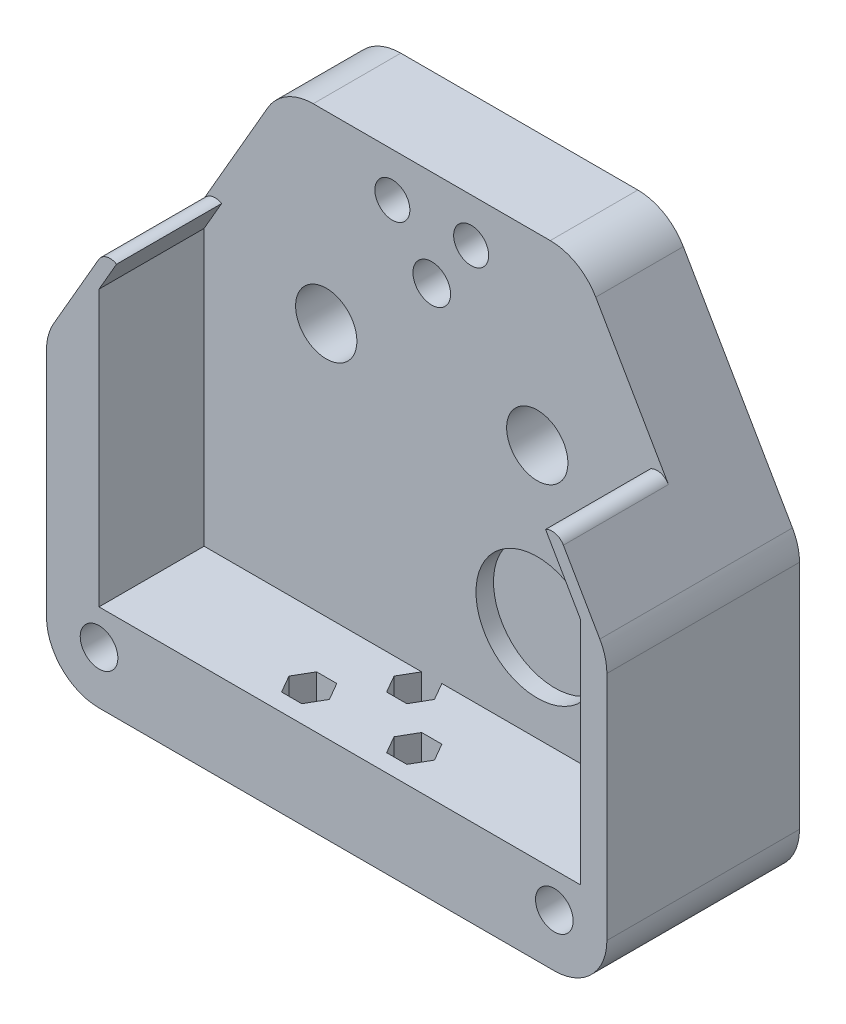
from build123d import *

# Parameters (mm, degrees)
EXTRUDE_1_DEPTH             = 10
EXTRUDE_2_DEPTH             = 12
FILLET_1_R                  = 6
FILLET_2_R                  = 1.49
HOLE_WIZARD_M44_D           = 4.3
HOLE_WIZARD_M44_CSINK_D     = 8.7
HOLE_WIZARD_M44_CSINK_ANGLE = 90
HOLE_WIZARD_4_0_2_D         = 4
HOLE_WIZARD_4_0_2_DEPTH     = 6
HOLE_WIZARD_4_0_2_TIP       = 1.2017212380551205
HOLE_WIZARD_7_0_7_1_D       = 7
HOLE_WIZARD_7_0_7_1_DEPTH   = 6
HOLE_WIZARD_7_0_7_1_TIP     = 2.103012166596461
SKETCH_54_R                 = 6.999999999999999
CUT_EXTRUDE_5_DEPTH         = 2
HOLE_WIZARD_M2_21_D         = 2
HOLE_WIZARD_M2_21_DEPTH     = 10
HOLE_WIZARD_M2_21_TIP       = 0.6008606190275603
CUT_EXTRUDE_11_DEPTH        = 4
HOLE_WIZARD_M2_22_D         = 2
HOLE_WIZARD_M2_22_DEPTH     = 10
HOLE_WIZARD_M2_22_TIP       = 0.6008606190275603
CUT_EXTRUDE_12_DEPTH        = 4


with BuildPart() as part:
    # Эскиз1 → Бобышка-Вытянуть1 (new body)
    with BuildSketch(Plane.XY):
        Polygon((0, 0), (64, 0), (64.00000000000001, 34.01923788646688), (48.99999999999994, 59.99999999999999), (14.999999999999943, 59.99999999999999), (0, 34.02), align=None)
    extrude(amount=EXTRUDE_1_DEPTH)

    # Эскиз3 → Бобышка-Вытянуть2 (add)
    with BuildSketch(Plane.XY.offset(10)):
        Polygon((0, 0), (64, 0), (64.00000000000001, 34.01923788646688), (58.29037785163881, 43.90859353944907), (57, 43.16359353944907), (60.99999999999999, 36.23539030917355), (61.00000000000001, 9.999999999999998), (6.000000000000005, 9.999999999999993), (6, 41.43206556072121), (8.000044001452048, 44.896141771236174), (6.709675613035229, 45.64115816177706), (0, 34.02), align=None)
    extrude(amount=EXTRUDE_2_DEPTH)

    # Скругление1
    fillet_1_edges = [part.edges().sort_by_distance(p)[0] for p in [
        (0, 34.02, 11),
        (14.999999999999943, 59.99999999999999, 5),
        (48.99999999999994, 59.99999999999999, 5),
        (64.00000000000001, 34.01923788646688, 11),
        (64, 0, 11),
        (0, 0, 11),
    ]]
    fillet(fillet_1_edges, radius=FILLET_1_R)

    # Скругление2
    fillet_2_edges = [part.edges().sort_by_distance(p)[0] for p in [
        (58.29037785163881, 43.90859353944907, 16),
        (6.709675613035229, 45.64115816177706, 16),
    ]]
    fillet(fillet_2_edges, radius=FILLET_2_R - 0.0001)  # a hair under: the kernel refuses the full size

    # Зенковка для  винта с плоской головкой M44 (through all)
    with Locations(Plane(origin=(0, 0, 0), x_dir=(-1, 0, 0), z_dir=(0, 0, -1))):
        with Locations((-5.999949191, 6), (-58, 6), (-31.999974596, 49)):
            CounterSinkHole(HOLE_WIZARD_M44_D / 2, HOLE_WIZARD_M44_CSINK_D / 2, counter_sink_angle=HOLE_WIZARD_M44_CSINK_ANGLE)

    # Отверстия под штифты Ø4.0 мм2
    with Locations(Plane(origin=(0, 0, 10), x_dir=(-1, 0, 0), z_dir=(0, 0, 1))):
        with Locations((-36.5, -55), (-27.499949191, -55)):
            Hole(HOLE_WIZARD_4_0_2_D / 2, depth=HOLE_WIZARD_4_0_2_DEPTH)
            with Locations((0, 0, -(HOLE_WIZARD_4_0_2_DEPTH + HOLE_WIZARD_4_0_2_TIP / 2))):  # 118° drill point
                Cone(0, HOLE_WIZARD_4_0_2_D / 2, HOLE_WIZARD_4_0_2_TIP, mode=Mode.SUBTRACT)

    # Диаметр отверстия Ø7.0 (7)1
    with Locations(Plane(origin=(0, 0, 10), x_dir=(-1, 0, 0), z_dir=(0, 0, 1))):
        with Locations((-44.05, -39), (-19.949949191, -39)):
            Hole(HOLE_WIZARD_7_0_7_1_D / 2, depth=HOLE_WIZARD_7_0_7_1_DEPTH)
            with Locations((0, 0, -(HOLE_WIZARD_7_0_7_1_DEPTH + HOLE_WIZARD_7_0_7_1_TIP / 2))):  # 118° drill point
                Cone(0, HOLE_WIZARD_7_0_7_1_D / 2, HOLE_WIZARD_7_0_7_1_TIP, mode=Mode.SUBTRACT)

    # Эскиз54 → Вырез-Вытянуть5 (cut)
    with BuildSketch(Plane.XY.offset(10)):
        with Locations((44.050000000000004, 21)):
            Circle(SKETCH_54_R)
    extrude(amount=-CUT_EXTRUDE_5_DEPTH, mode=Mode.SUBTRACT)

    # Сверло под метчик  спиральное M2.21
    with Locations(Plane(origin=(0, 0, 0), x_dir=(-1, 0, 0), z_dir=(0, -1, 0))):
        with Locations((-26, -18), (-38, -18)):
            Hole(HOLE_WIZARD_M2_21_D / 2, depth=HOLE_WIZARD_M2_21_DEPTH)
            with Locations((0, 0, -(HOLE_WIZARD_M2_21_DEPTH + HOLE_WIZARD_M2_21_TIP / 2))):  # 118° drill point
                Cone(0, HOLE_WIZARD_M2_21_D / 2, HOLE_WIZARD_M2_21_TIP, mode=Mode.SUBTRACT)

    # Эскиз58 → Вырез-Вытянуть11 (cut)
    with BuildSketch(Plane(origin=(-9.5e-16, 9.999999999999993, 0), x_dir=(1, 9e-17, 0), z_dir=(-9e-17, 1, 0))):
        Polygon((28.309401076758505, -17.999999999999993), (27.154700538379252, -15.99999999999999), (24.845299461620748, -15.999999999999986), (23.690598923241495, -17.999999999999986), (24.845299461620744, -19.999999999999982), (27.154700538379256, -19.999999999999986), align=None)
        Polygon((40.3094010767585, -17.999999999999993), (39.154700538379245, -15.999999999999993), (36.845299461620755, -15.99999999999999), (35.6905989232415, -17.999999999999996), (36.84529946162075, -19.999999999999993), (39.15470053837924, -19.999999999999996), align=None)
    extrude(amount=-CUT_EXTRUDE_11_DEPTH, mode=Mode.SUBTRACT)

    # Сверло под метчик  спиральное M2.22
    with Locations(Plane(origin=(0, 0, 0), x_dir=(-1, 0, 0), z_dir=(0, -1, 0))):
        with Locations((-32, -12)):
            Hole(HOLE_WIZARD_M2_22_D / 2, depth=HOLE_WIZARD_M2_22_DEPTH)
            with Locations((0, 0, -(HOLE_WIZARD_M2_22_DEPTH + HOLE_WIZARD_M2_22_TIP / 2))):  # 118° drill point
                Cone(0, HOLE_WIZARD_M2_22_D / 2, HOLE_WIZARD_M2_22_TIP, mode=Mode.SUBTRACT)

    # Эскиз61 → Вырез-Вытянуть12 (cut)
    with BuildSketch(Plane(origin=(-9.5e-16, 9.999999999999993, 0), x_dir=(1, 9e-17, 0), z_dir=(-9e-17, 1, 0))):
        Polygon((34.3094010767585, -11.999999999999998), (33.15470053837925, -10.000000000000002), (30.84529946162075, -9.999999999999998), (29.690598923241495, -11.999999999999996), (30.845299461620744, -13.999999999999996), (33.15470053837924, -14), align=None)
    extrude(amount=-CUT_EXTRUDE_12_DEPTH, mode=Mode.SUBTRACT)


solid = part.part
